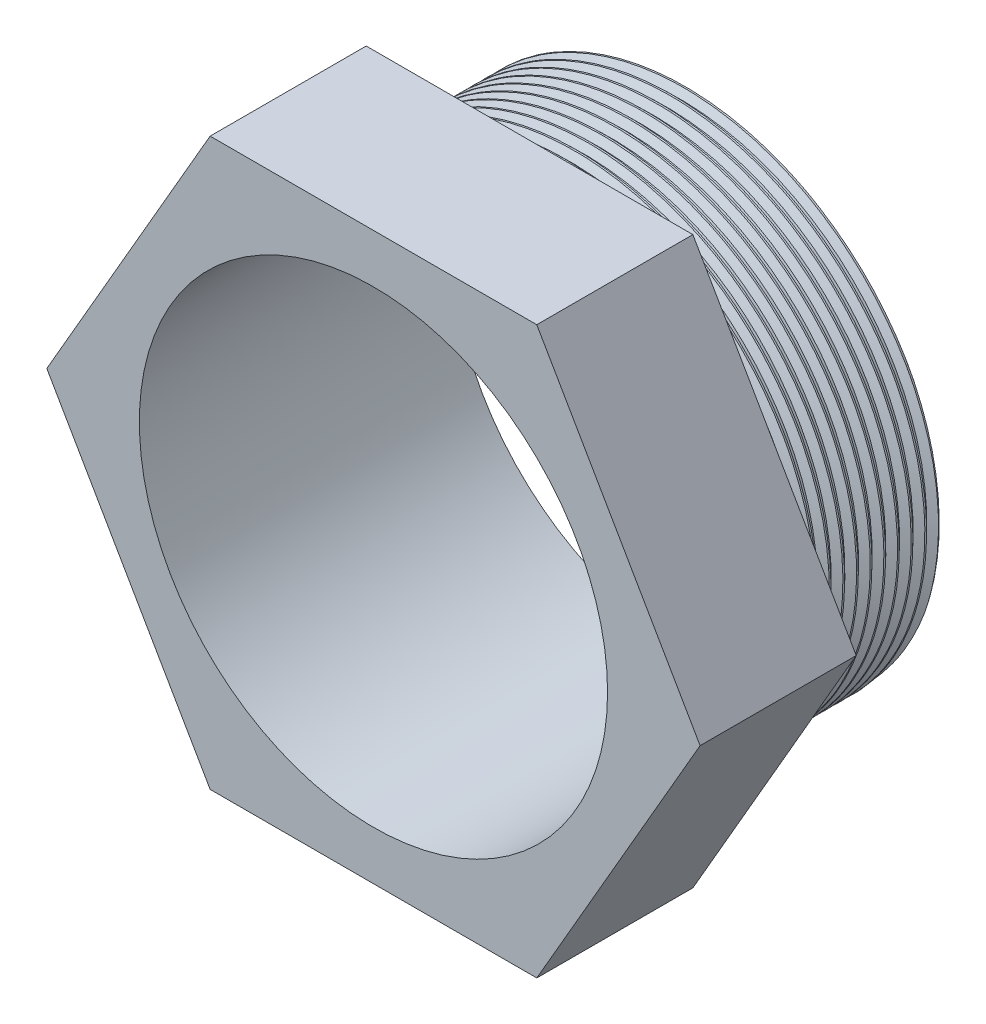
from build123d import *

# Parameters (mm, degrees)
SKETCH1_R           = 6.5
SKETCH1_R_2         = 6
BOSS_EXTRUDE2_DEPTH = 4
BOSS_EXTRUDE3_START = -4
SKETCH1_5_R         = 6.5
SKETCH1_5_R_2       = 6
BOSS_EXTRUDE3_DEPTH = 4
THREAD1_PITCH       = 0.35


with BuildPart() as part:
    # Sketch1 → Boss-Extrude2 (new body)
    # profile 1 of 2: a face of its own
    with BuildSketch(Plane.XY):
        Polygon((-8.371578903, 0), (-4.185789452, -7.25), (4.185789452, -7.25), (8.371578903, 0), (4.185789452, 7.25), (-4.185789452, 7.25), align=None)
        Circle(SKETCH1_R, mode=Mode.SUBTRACT)
    # profile 2 of 2: a face of its own
    with BuildSketch(Plane.XY):
        Circle(SKETCH1_R)
        Circle(SKETCH1_R_2, mode=Mode.SUBTRACT)
    extrude(amount=BOSS_EXTRUDE2_DEPTH)

    # Sketch1<5> → Boss-Extrude3 (add)
    with BuildSketch(Plane.XY.offset(BOSS_EXTRUDE3_START)):
        Circle(SKETCH1_5_R)
        Circle(SKETCH1_5_R_2, mode=Mode.SUBTRACT)
    extrude(amount=BOSS_EXTRUDE3_DEPTH)

    # Thread1: the profile of Thread Profile1 profile screwed along a right-hand helix of 11.428571 turns, 6 arcs to a turn; built about Z, then put on its axis
    thread1_z = Axis((0, 0, 0), (0, 0, 1))
    thread1_corners = [(6.5003, 0, -0.000173205), (6.5003, 0, 0.306423204), (6.310556944, 0, 0.196875), (6.310556944, 0, 0.109375)]
    with BuildLine(mode=Mode.PRIVATE) as thread1_profile:
        Line(thread1_corners[0], thread1_corners[1])
        Line(thread1_corners[1], thread1_corners[2])
        Line(thread1_corners[2], thread1_corners[3])
        Line(thread1_corners[3], thread1_corners[0])
    thread1_cap = Face(thread1_profile.wire())
    thread1_turn_angles = [0, 30, 60, 90, 120, 150, 180, 210, 240, 270, 300, 330, 360]
    thread1_turn_weights = [1, 0.8660254037844387, 1, 0.8660254037844387, 1, 0.8660254037844387, 1, 0.8660254037844387, 1, 0.8660254037844387, 1, 0.8660254037844387, 1]
    thread1_turn_rails = [Edge.make_bspline([Vector(p[0], p[1], 0).rotate(thread1_z, thread1_turn_angles[k]) / thread1_turn_weights[k] + Vector(0, 0, p[2] + THREAD1_PITCH * thread1_turn_angles[k] / 360) for k in range(13)], [0, 0, 0, 1, 1, 2, 2, 3, 3, 4, 4, 5, 5, 6, 6, 6], 2, thread1_turn_weights) for p in thread1_corners]
    thread1_turn_sides = [Face.make_surface_from_curves(thread1_turn_rails[p[0]], thread1_turn_rails[p[1]]) for p in [(0, 1), (1, 2), (2, 3), (3, 0)]]
    thread1_last_angles = [3960, 3990, 4020, 4050, 4080, 4097.142857143, 4114.285714286]
    thread1_last_weights = [1, 0.8660254037844387, 1, 0.8660254037844387, 1, 0.9555728057861397, 1]
    thread1_last_rails = [Edge.make_bspline([Vector(p[0], p[1], 0).rotate(thread1_z, thread1_last_angles[k]) / thread1_last_weights[k] + Vector(0, 0, p[2] + THREAD1_PITCH * thread1_last_angles[k] / 360) for k in range(7)], [0, 0, 0, 1, 1, 2, 2, 3, 3, 3], 2, thread1_last_weights) for p in thread1_corners]
    thread1_last_sides = [Face.make_surface_from_curves(thread1_last_rails[p[0]], thread1_last_rails[p[1]]) for p in [(0, 1), (1, 2), (2, 3), (3, 0)]]
    thread1 = Plane(origin=(0, 0, 0), x_dir=(-1, 0, 0), z_dir=(0, 0, -1)) * Solid(Shell([*[p.moved(Location((0, 0, THREAD1_PITCH * i))) for i in range(11) for p in thread1_turn_sides], *thread1_last_sides, thread1_cap, thread1_cap.rotate(thread1_z, 4114.285714286).moved(Location((0, 0, THREAD1_PITCH * 4114.285714286 / 360)))]))
    add(thread1, mode=Mode.SUBTRACT)


solid = part.part
